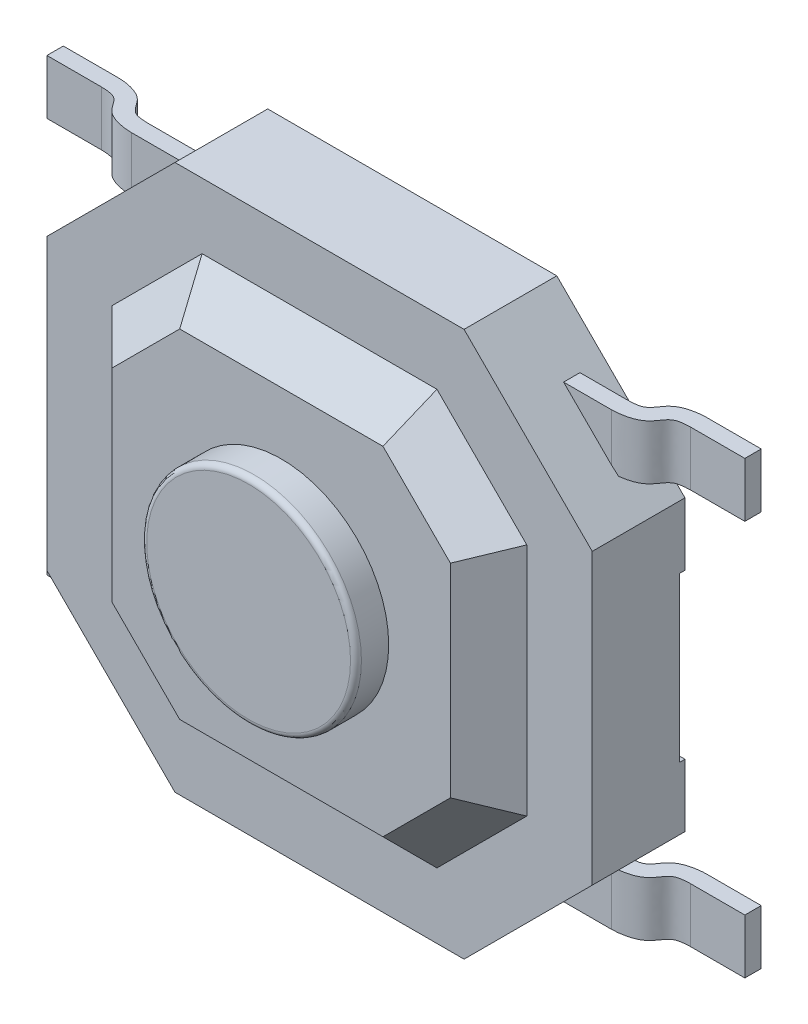
from build123d import *

# Parameters (mm, degrees)
BASE_DEPTH              = 0.8636
TIER1_DEPTH             = 0.3556
CHAMFER1_SIZE           = 0.3556
SKETCH3_R               = 1
BUTTON_DEPTH            = 0.3048
BUTTONC_R               = 0.0508
SKETCH4_W               = 5.08
SKETCH4_H               = 1.524
BOTTOM_CUT_DEPTH        = 0.0508
PINS_START              = -0.4445
SKETCH6_W               = 0.508
SKETCH6_H               = 0.1524
PINS_DEPTH              = 0.508
MIRROR2_START           = -0.4445
MIRROR2_COPY_1_SKETCH_W = 0.508
MIRROR2_COPY_1_SKETCH_H = 0.1524
MIRROR2_COPY_1_DEPTH    = 0.508


with BuildPart() as part:
    # Sketch1 → Base (new body)
    with BuildSketch(Plane.XY):
        Polygon((-1.3462, 2.54), (1.3462, 2.54), (2.54, 1.3462), (2.54, -1.3462), (1.3462, -2.54), (-1.3462, -2.54), (-2.54, -1.3462), (-2.54, 1.3462), align=None)
    extrude(amount=BASE_DEPTH)

    # Sketch2 → Tier1 (add)
    with BuildSketch(Plane.XY.offset(0.8636)):
        Polygon((-1.093695412, 1.9304), (-1.9304, 1.093695412), (-1.9304, -1.093695412), (-1.093695412, -1.9304), (1.093695412, -1.9304), (1.9304, -1.093695412), (1.9304, 1.093695412), (1.093695412, 1.9304), align=None)
    extrude(amount=TIER1_DEPTH)

    # Chamfer1
    chamfer1_edges = [part.edges().sort_by_distance(p)[0] for p in [
        (-1.512047706, 1.512047706, 1.2192),
        (0, 1.9304, 1.2192),
        (1.512047706, 1.512047706, 1.2192),
        (1.9304, 0, 1.2192),
        (1.512047706, -1.512047706, 1.2192),
        (0, -1.9304, 1.2192),
        (-1.512047706, -1.512047706, 1.2192),
        (-1.9304, 0, 1.2192),
    ]]
    chamfer(chamfer1_edges, length=CHAMFER1_SIZE - 0.0001)  # a hair under: the kernel refuses the full size

    # Sketch3 → Button (add)
    with BuildSketch(Plane.XY.offset(1.2192)):
        Circle(SKETCH3_R)
    extrude(amount=BUTTON_DEPTH)

    # ButtonC
    buttonc_edges = [part.edges().sort_by_distance(p)[0] for p in [
        (-1, 0, 1.524),
    ]]
    fillet(buttonc_edges, radius=BUTTONC_R)

    # Sketch4 → Bottom cut (cut)
    with BuildSketch(Plane(origin=(0, 0, 0), x_dir=(-1, 0, 0), z_dir=(0, 0, -1))):
        Rectangle(SKETCH4_W, SKETCH4_H)
    extrude(amount=-BOTTOM_CUT_DEPTH, mode=Mode.SUBTRACT)

    # Sketch6 → pins (add)
    with BuildSketch(Plane.XZ.offset(2.54).offset(PINS_START)):
        with Locations((-1.0922, 0.3048)):
            Rectangle(SKETCH6_W, SKETCH6_H)
        Polygon((-1.3462, 0.2286), (-1.3462, 0.381), (-2.2352, 0.381), (-2.2352, 0.3048), (-2.2352, 0.2286), align=None)
        with BuildLine():
            Line((-2.2352, 0.3048), (-2.2352, 0.381))
            add(Edge.make_bspline(
                [(-2.2352, 0.381), (-2.307735088, 0.381), (-2.477008689, 0.347316172), (-2.556176281, 0.222815828), (-2.591192004, 0.183226461), (-2.642048799, 0.15910292), (-2.712296659, 0.1524), (-2.742, 0.1524)],
                knots=[0, 0, 0, 0, 0.25, 0.5, 0.75, 0.875, 1, 1, 1, 1], degree=3))
            Line((-2.742, 0.1524), (-2.742, 0.0762))
            add(Edge.make_bspline(
                [(-2.2352, 0.3048), (-2.573866667, 0.3048), (-2.403333333, 0.0762), (-2.742, 0.0762)],
                knots=[0, 0, 0, 0, 1, 1, 1, 1], degree=3))
        make_face()
        with BuildLine():
            Line((-2.2352, 0.2286), (-2.2352, 0.3048))
            add(Edge.make_bspline(
                [(-2.2352, 0.3048), (-2.573866667, 0.3048), (-2.403333333, 0.0762), (-2.742, 0.0762)],
                knots=[0, 0, 0, 0, 1, 1, 1, 1], degree=3))
            Line((-2.742, 0.0762), (-2.742, 0))
            add(Edge.make_bspline(
                [(-2.2352, 0.2286), (-2.264903341, 0.2286), (-2.335151201, 0.22189708), (-2.386007996, 0.197773539), (-2.421023719, 0.158184172), (-2.500191311, 0.033683828), (-2.669464912, 0), (-2.742, 0)],
                knots=[0, 0, 0, 0, 0.125, 0.25, 0.5, 0.75, 1, 1, 1, 1], degree=3))
        make_face()
        with Locations((-2.996, 0.0762)):
            Rectangle(SKETCH6_W, SKETCH6_H)
    pins = extrude(amount=-PINS_DEPTH)

    # pins2: pins across plane
    add(pins.mirror(Plane.ZX))

    # Mirror2: pins across plane
    add(pins.mirror(Plane(origin=(0, 0, 0), x_dir=(0, 0, 1), z_dir=(1, 0, 0))))

    # Mirror2 copy 1 sketch → Mirror2 copy 1 (add)
    with BuildSketch(Plane(origin=(0, 2.54, 0), x_dir=(-1, 0, 0), z_dir=(0, 1, 0)).offset(MIRROR2_START)):
        with Locations((-1.0922, 0.3048)):
            Rectangle(MIRROR2_COPY_1_SKETCH_W, MIRROR2_COPY_1_SKETCH_H)
        Polygon((-1.3462, 0.2286), (-1.3462, 0.381), (-2.2352, 0.381), (-2.2352, 0.3048), (-2.2352, 0.2286), align=None)
        with BuildLine():
            Line((-2.2352, 0.3048), (-2.2352, 0.381))
            add(Edge.make_bspline(
                [(-2.2352, 0.381), (-2.307735088, 0.381), (-2.477008689, 0.347316172), (-2.556176281, 0.222815828), (-2.591192004, 0.183226461), (-2.642048799, 0.15910292), (-2.712296659, 0.1524), (-2.742, 0.1524)],
                knots=[0, 0, 0, 0, 0.25, 0.5, 0.75, 0.875, 1, 1, 1, 1], degree=3))
            Line((-2.742, 0.1524), (-2.742, 0.0762))
            add(Edge.make_bspline(
                [(-2.2352, 0.3048), (-2.573866667, 0.3048), (-2.403333333, 0.0762), (-2.742, 0.0762)],
                knots=[0, 0, 0, 0, 1, 1, 1, 1], degree=3))
        make_face()
        with BuildLine():
            Line((-2.2352, 0.2286), (-2.2352, 0.3048))
            add(Edge.make_bspline(
                [(-2.2352, 0.3048), (-2.573866667, 0.3048), (-2.403333333, 0.0762), (-2.742, 0.0762)],
                knots=[0, 0, 0, 0, 1, 1, 1, 1], degree=3))
            Line((-2.742, 0.0762), (-2.742, 0))
            add(Edge.make_bspline(
                [(-2.2352, 0.2286), (-2.264903341, 0.2286), (-2.335151201, 0.22189708), (-2.386007996, 0.197773539), (-2.421023719, 0.158184172), (-2.500191311, 0.033683828), (-2.669464912, 0), (-2.742, 0)],
                knots=[0, 0, 0, 0, 0.125, 0.25, 0.5, 0.75, 1, 1, 1, 1], degree=3))
        make_face()
        with Locations((-2.996, 0.0762)):
            Rectangle(MIRROR2_COPY_1_SKETCH_W, MIRROR2_COPY_1_SKETCH_H)
    extrude(amount=-MIRROR2_COPY_1_DEPTH)


solid = part.part
